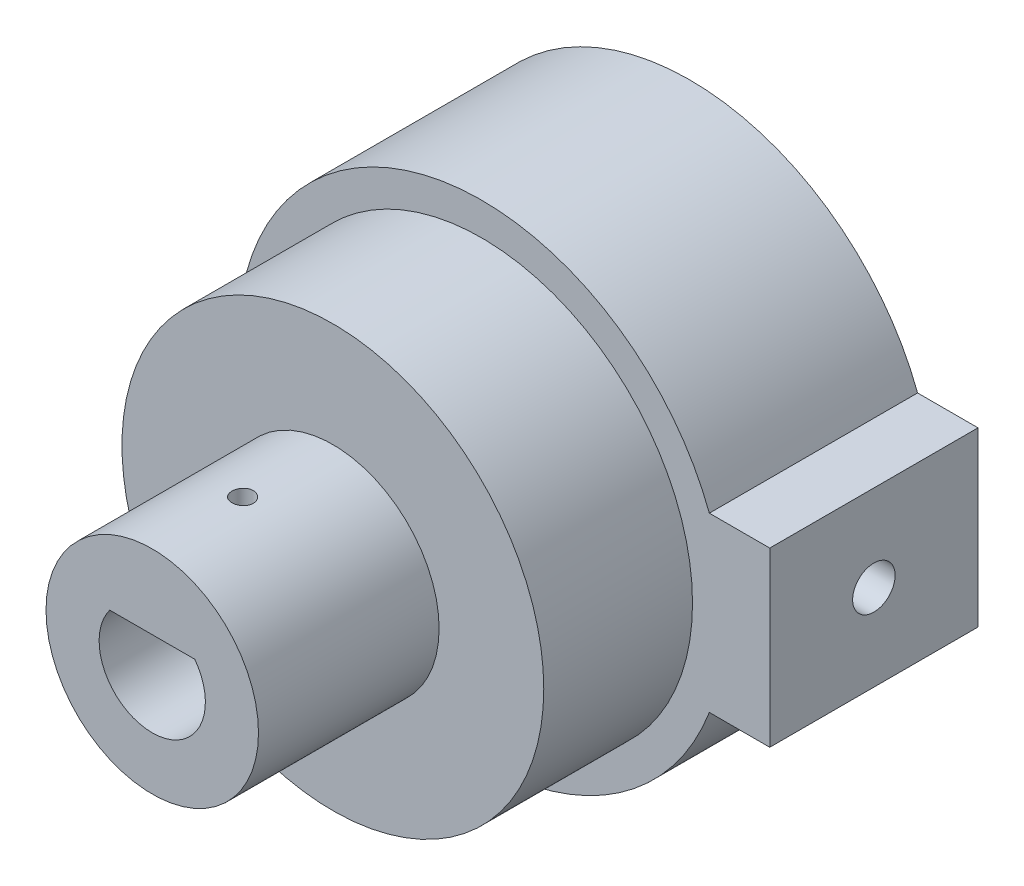
from build123d import *

# Parameters (mm, degrees)
SKETCH1_W           = 13.5
SKETCH1_H           = 13.5
BOSS_EXTRUDE1_DEPTH = 9.8
SKETCH2_R           = 9.925
BOSS_EXTRUDE2_DEPTH = 7
SKETCH3_W           = 13.5
SKETCH3_H           = 13.5
CUT_EXTRUDE1_DEPTH  = 5
SKETCH4_R           = 5
BOSS_EXTRUDE3_DEPTH = 8.5
SKETCH5_R           = 1
CUT_EXTRUDE2_DEPTH  = 10.5
SKETCH6_R           = 0.5
CUT_EXTRUDE3_DEPTH  = 3.5
SKETCH7_W           = 3.5
SKETCH7_H           = 8.12
CUT_EXTRUDE4_DEPTH  = 10.5


with BuildPart() as part:
    # Sketch1 → Boss-Extrude1 (new body)
    with BuildSketch(Plane.XY):
        with BuildLine():
            Line((17.06, 4.06), (10.716715915, 4.06))
            ThreePointArc((10.716715915, 4.06), (-11.46, 0), (10.716715915, -4.06))
            Line((10.716715915, -4.06), (17.06, -4.06))
            Line((17.06, -4.06), (17.06, 4.06))
        make_face()
        Rectangle(SKETCH1_W, SKETCH1_H, mode=Mode.SUBTRACT)
    extrude(amount=BOSS_EXTRUDE1_DEPTH)

    # Sketch2 → Boss-Extrude2 (add)
    with BuildSketch(Plane.XY.offset(9.8)):
        Circle(SKETCH2_R)
    extrude(amount=BOSS_EXTRUDE2_DEPTH)

    # Sketch3 → Cut-Extrude1 (cut)
    with BuildSketch(Plane(origin=(0, 0, 9.8), x_dir=(-1, 0, 0), z_dir=(0, 0, -1))):
        Rectangle(SKETCH3_W, SKETCH3_H)
    extrude(amount=-CUT_EXTRUDE1_DEPTH, mode=Mode.SUBTRACT)

    # Sketch4 → Boss-Extrude3 (add)
    with BuildSketch(Plane.XY.offset(16.8)):
        Circle(SKETCH4_R)
        with BuildLine():
            Line((2, 1.5), (-2, 1.5))
            ThreePointArc((-2, 1.5), (0, -2.5), (2, 1.5))
        make_face(mode=Mode.SUBTRACT)
    extrude(amount=BOSS_EXTRUDE3_DEPTH)

    # Sketch5 → Cut-Extrude2 (cut)
    with BuildSketch(Plane(origin=(17.06, 0, 0), x_dir=(0, 0, -1), z_dir=(1, 0, 0))):
        with Locations((-4.9, 0)):
            Circle(SKETCH5_R)
    extrude(amount=-CUT_EXTRUDE2_DEPTH, mode=Mode.SUBTRACT)

    # Sketch6 → Cut-Extrude3 (cut)
    with BuildSketch(Plane.XZ.offset(-1.5)):
        with Locations((0, 21.05)):
            Circle(SKETCH6_R)
    extrude(amount=-CUT_EXTRUDE3_DEPTH, mode=Mode.SUBTRACT)

    # Sketch7 → Cut-Extrude4 (cut)
    with BuildSketch(Plane(origin=(0, 0, 0), x_dir=(-1, 0, 0), z_dir=(0, 0, -1))):
        with Locations((-15.31, 0)):
            Rectangle(SKETCH7_W, SKETCH7_H)
    extrude(amount=-CUT_EXTRUDE4_DEPTH, mode=Mode.SUBTRACT)


solid = part.part
